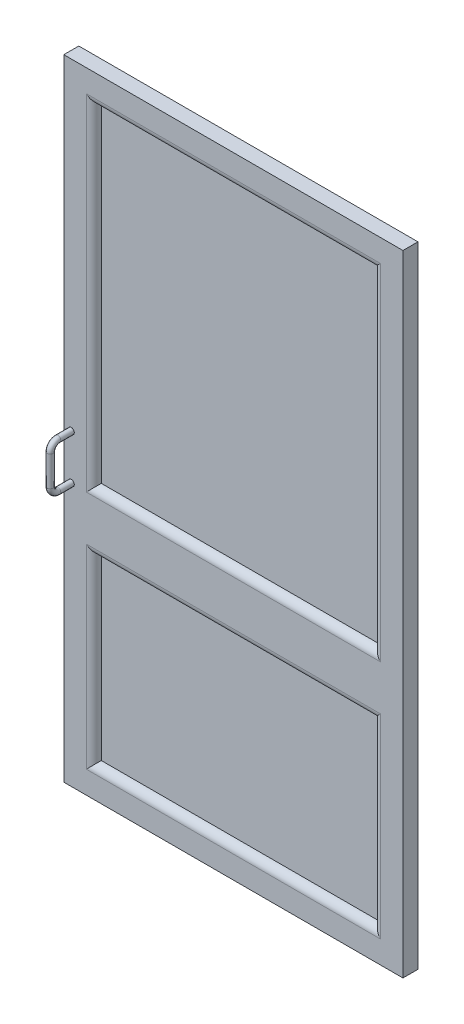
from build123d import *

# Parameters (mm, degrees)
SKETCH1_W           = 1130.428324658
SKETCH1_H           = 2100
BOSS_EXTRUDE1_DEPTH = 50
SKETCH3_W           = 930.428324658
SKETCH3_H           = 600
SKETCH3_H_2         = 1100
CUT_EXTRUDE1_DEPTH  = 25
FILLET1_R           = 25
SKETCH5_R           = 10
SCALE2_SCALE        = 0.25
SCALE3_SCALE        = 0.32


with BuildPart() as part:
    # Sketch1 → Boss-Extrude1 (new body)
    with BuildSketch(Plane.XY):
        with Locations((565.214162329, 1050)):
            Rectangle(SKETCH1_W, SKETCH1_H)
    extrude(amount=BOSS_EXTRUDE1_DEPTH)

    # Sketch3 → Cut-Extrude1 (cut)
    with BuildSketch(Plane.XY.offset(50)):
        with Locations((565.214162329, 400)):
            Rectangle(SKETCH3_W, SKETCH3_H)
        with Locations((565.214162329, 1450)):
            Rectangle(SKETCH3_W, SKETCH3_H_2)
    extrude(amount=-CUT_EXTRUDE1_DEPTH, mode=Mode.SUBTRACT)

    # Fillet1
    fillet1_edges = [part.edges().sort_by_distance(p)[0] for p in [
        (565.214162329, 100, 50),
        (100, 400, 50),
        (1030.428324658, 400, 50),
        (565.214162329, 700, 50),
        (100, 1450, 50),
        (565.214162329, 900, 50),
        (1030.428324658, 1450, 50),
        (565.214162329, 2000, 50),
    ]]
    fillet(fillet1_edges, radius=FILLET1_R - 0.0001)  # a hair under: the kernel refuses the full size

    # Sweep1: sweep along a path in Sketch4
    with BuildLine(Plane.ZY.offset(-25)) as sweep1_path:
        Line((50, 1026.385549177), (95, 1026.385549177))
        ThreePointArc((95, 1026.385549177), (112.67766953, 1019.063218707), (120, 1001.385549177))
        Line((120, 1001.385549177), (120, 901.385549177))
        ThreePointArc((120, 901.385549177), (112.67766953, 883.707879648), (95, 876.385549177))
        Line((95, 876.385549177), (48.369845226, 876.385549177))
    # Sketch5 → Sweep1 (sweep)
    with BuildSketch(Plane.XY.offset(50)):
        with Locations((25, 1026.385549177)):
            Circle(SKETCH5_R)
    sweep(path=sweep1_path.line)


with BuildPart() as part_1:
    # Scale2: scaled about (0, 0, 0)
    add(part.part.scale(SCALE2_SCALE))


with BuildPart() as part_2:
    # Scale3: scaled about (0, 0, 0)
    add(part_1.part.scale(SCALE3_SCALE))


solid = part_2.part
